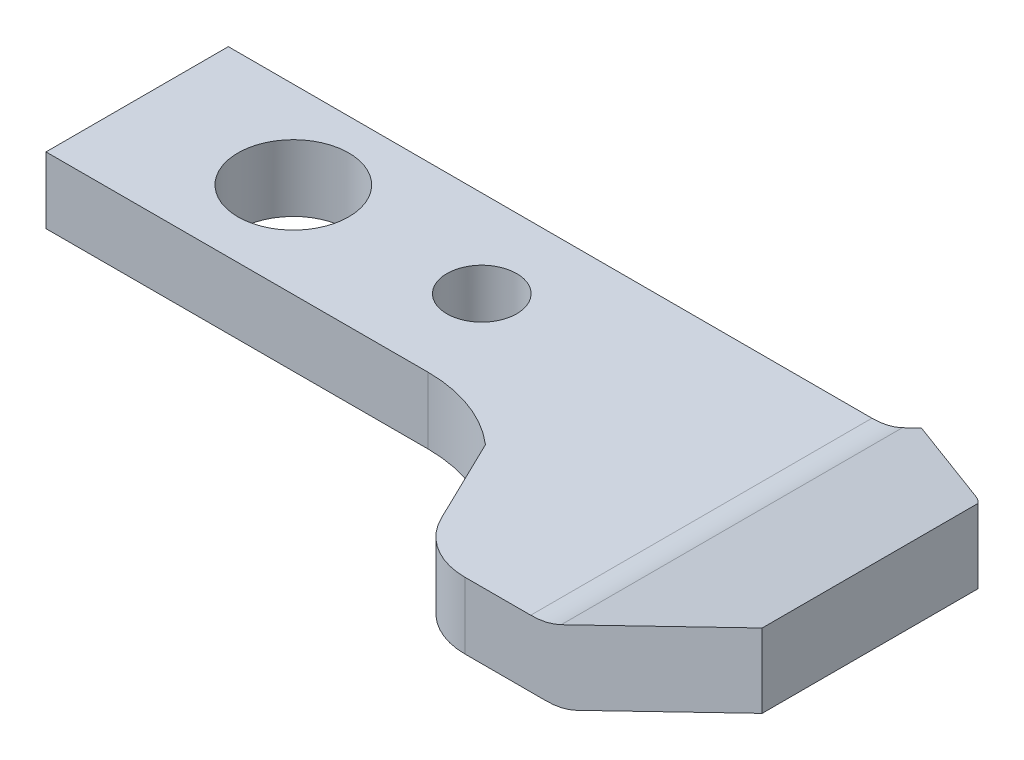
from build123d import *

# Parameters (mm, degrees)
SALIENTE_EXTRUIR1_DEPTH    = 100
CORTAR_EXTRUIR3_START      = -9.53
CORTAR_EXTRUIR3_DEPTH      = 27.53
CORTAR_EXTRUIR4_DEPTH      = 217.130875219
CORTAR_EXTRUIR4_DEPTH_BACK = 217.130875219
CROQUIS5_R                 = 6
CORTAR_EXTRUIR5_DEPTH      = 216.124741308
CORTAR_EXTRUIR5_DEPTH_BACK = 216.124741308
CROQUIS6_R                 = 5
SALIENTE_EXTRUIR5_START    = 15.13
CROQUIS12_R                = 8
CROQUIS12_R_2              = 6
SALIENTE_EXTRUIR5_DEPTH    = 15.13
CROQUIS14_R                = 10
CROQUIS14_R_2              = 6
SALIENTE_EXTRUIR6_DEPTH    = 14.13
REDONDEO1_R                = 10
CROQUIS15_R                = 129.913958972
CORTAR_EXTRUIR6_DEPTH      = 241.731126452
CORTAR_EXTRUIR7_DEPTH      = 241.731126452
CORTAR_EXTRUIR7_DEPTH_BACK = 241.731126452
CROQUIS16_R                = 167.818918699
CROQUIS16_W                = 152.833455663
CROQUIS16_H                = 57.32474986
CROQUIS17_R                = 7.94
CORTAR_EXTRUIR8_DEPTH      = 275.18730081


# Read off the part's stored shape, not the designer's step: Cortar-Extruir3
with BuildPart() as part:
    # Croquis1 → Saliente-Extruir1 (new body)
    with BuildSketch(Plane(origin=(0, 0, 0), x_dir=(-1, 0, 0), z_dir=(0, 0, 1))):
        Polygon((197, -18), (95.487511072, -18), (58.434265153, 0), (0, 0), (0, -9.53), (56.241982635, -9.53), (93.295228555, -27.53), (197, -27.53), align=None)
    extrude(amount=SALIENTE_EXTRUIR1_DEPTH)

    # Cortar-Extruir3 outline → Cortar-Extruir3 (cut)
    with BuildSketch(Plane.XZ.offset(-18).offset(CORTAR_EXTRUIR3_START)):
        with BuildLine():
            ThreePointArc((-55.249840127, 84.500440573), (-26.332291795, 96.782267833), (-21.152892526, 65.794500802))
            Line((-21.152892526, 65.794500802), (-64.625951049, 17.972279409))
            ThreePointArc((-64.625951049, 17.972279409), (-65.478127712, 17.140282818), (-66.423173576, 16.415498915))
            Line((-66.423173576, 16.415498915), (-90.606375863, 0.05961622))
            ThreePointArc((-90.606375863, 0.05961622), (-90.650882543, 0.029688544), (-90.695549093, 0))
            Line((-90.695549093, 0), (0, 0))
            Line((0, 0), (0, 100))
            Line((0, 100), (-197, 100))
            Line((-197, 100), (-197, 0))
            Line((-197, 0), (-190.011984345, 0))
            Line((-190.011984345, 0), (-190.011984345, 26.126101457))
            Line((-190.011984345, 26.126101457), (-135.299104154, 26.091319242))
            ThreePointArc((-135.299104154, 26.091319242), (-128.302319283, 27.350377114), (-122.187975643, 30.977363067))
            Line((-122.187975643, 30.977363067), (-116.240808663, 43.251828603))
            ThreePointArc((-116.240808663, 43.251828603), (-112.551713447, 47.365099857), (-107.241491018, 48.891521053))
            Line((-107.241491018, 48.891521053), (-89.308606426, 48.891521053))
            ThreePointArc((-89.308606426, 48.891521053), (-87.268864218, 49.101758455), (-85.31488803, 49.723630708))
            ThreePointArc((-85.31488803, 49.723630708), (-66.329070141, 63.694356674), (-55.249840127, 84.500440573))
        make_face()
    extrude(amount=CORTAR_EXTRUIR3_DEPTH, mode=Mode.SUBTRACT)

    # Croquis5 → Cortar-Extruir4 (cut, two sides: drawn at the far end of the back side and taken through both)
    with BuildSketch(Plane.XZ.offset(-CORTAR_EXTRUIR4_DEPTH_BACK)):
        with Locations(Location((-35.951954024, 79.247670643, 0), (0, 0, 270))):
            Circle(CROQUIS5_R)
    extrude(amount=CORTAR_EXTRUIR4_DEPTH + CORTAR_EXTRUIR4_DEPTH_BACK, mode=Mode.SUBTRACT)

    # Croquis6 → Cortar-Extruir5 (cut, two sides: drawn at the far end of the back side and taken through both)
    with BuildSketch(Plane.XZ.offset(-18).offset(-CORTAR_EXTRUIR5_DEPTH_BACK)):
        with Locations((-168.195527475, 12.5)):
            Circle(CROQUIS6_R)
        with Locations((-141.195527475, 12.5)):
            Circle(CROQUIS6_R)
    extrude(amount=CORTAR_EXTRUIR5_DEPTH + CORTAR_EXTRUIR5_DEPTH_BACK, mode=Mode.SUBTRACT)

    # Croquis12 → Saliente-Extruir5 (add)
    with BuildSketch(Plane.XZ.offset(SALIENTE_EXTRUIR5_START)):
        with Locations(Location((-35.951954024, 79.247670643, 0), (0, 0, 90))):
            Circle(CROQUIS12_R)
        with Locations(Location((-35.951954024, 79.247670643, 0), (0, 0, 270))):
            Circle(CROQUIS12_R_2, mode=Mode.SUBTRACT)
    extrude(amount=-SALIENTE_EXTRUIR5_DEPTH)

    # Croquis14 → Saliente-Extruir6 (add)
    with BuildSketch(Plane(origin=(0, -14.13, 0), x_dir=(-1, 0, 0), z_dir=(0, -1, 0))):
        with Locations(Location((35.951954024, -79.247670643, 0), (0, 0, 90))):
            Circle(CROQUIS14_R)
        with Locations(Location((35.951954024, -79.247670643, 0), (0, 0, 90))):
            Circle(CROQUIS14_R_2, mode=Mode.SUBTRACT)
    extrude(amount=-SALIENTE_EXTRUIR6_DEPTH)

    # Redondeo1
    redondeo1_edges = [part.edges().sort_by_distance(p)[0] for p in [
        (-95.487511072, 18, 24.445760526),
        (-58.434265153, 0, 50.31488072),
        (-93.295228555, 27.53, 24.445760526),
        (-56.241982635, 9.53, 54.230230798),
    ]]
    fillet(redondeo1_edges, radius=REDONDEO1_R)


with BuildPart() as body_2:
    # Simetría1: mirrored copy
    add(part.part.mirror(Plane(origin=(0, -82, 0), x_dir=(0, 0, 1), z_dir=(0, -1, 0))))


with BuildPart() as part_1:
    add(part.part)

    # Croquis15 → Cortar-Extruir6 (cut, through all)
    with BuildSketch(Plane(origin=(0, -82, 0), x_dir=(-1, 0, 0), z_dir=(0, -1, 0))):
        with Locations((137.546426993, -18.622395962)):
            Circle(CROQUIS15_R)
    extrude(amount=-CORTAR_EXTRUIR6_DEPTH, mode=Mode.SUBTRACT)


with BuildPart() as cortar_extruir7_tool:
    # Croquis16 → Cortar-Extruir7 (new, two sides: drawn at the far end of the back side and taken through both)
    with BuildSketch(Plane(origin=(0, -82, 0), x_dir=(-1, 0, 0), z_dir=(0, -1, 0)).offset(-CORTAR_EXTRUIR7_DEPTH_BACK)):
        with Locations((140.265045612, -47.269752677)):
            Circle(CROQUIS16_R)
        with Locations((141.042678881, -20.229146123)):
            Rectangle(CROQUIS16_W, CROQUIS16_H, mode=Mode.SUBTRACT)
    extrude(amount=CORTAR_EXTRUIR7_DEPTH + CORTAR_EXTRUIR7_DEPTH_BACK)


with BuildPart() as part_2:
    add(part_1.part)

    # Cortar-Extruir7: cut by cortar_extruir7_tool
    add(cortar_extruir7_tool.part, mode=Mode.SUBTRACT)


with BuildPart() as body_2_1:
    add(body_2.part)

    # Cortar-Extruir7: cut by cortar_extruir7_tool
    add(cortar_extruir7_tool.part, mode=Mode.SUBTRACT)

    # Croquis17 → Cortar-Extruir8 (cut, through all)
    with BuildSketch(Plane(origin=(0, 0, 0), x_dir=(1, 0, 0), z_dir=(0, 1, 0))):
        with Locations(Location((-168.195527475, -12.5, 0), (0, 0, 270))):
            Circle(CROQUIS17_R)
    extrude(amount=-CORTAR_EXTRUIR8_DEPTH, mode=Mode.SUBTRACT)


solid = body_2_1.part
